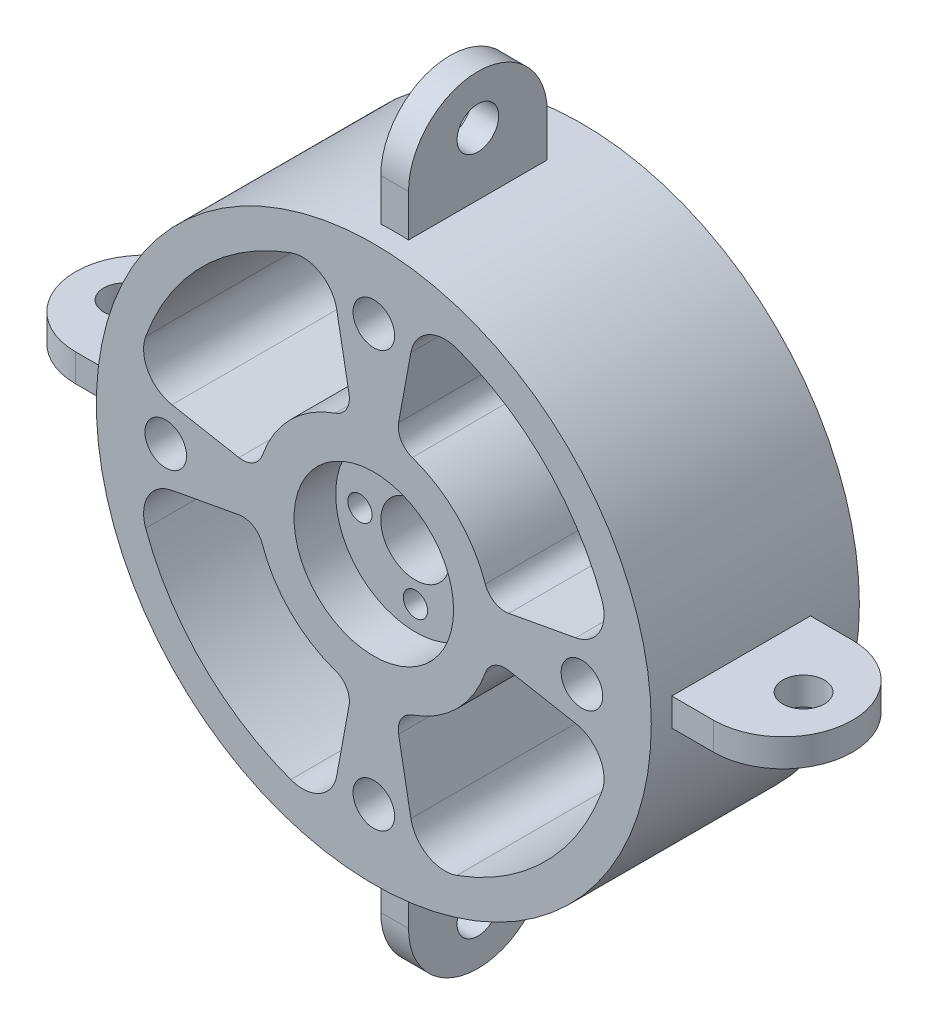
from build123d import *

# Parameters (mm, degrees)
SKETCH_1_R               = 40
EXTRUDE_1_DEPTH          = 30
SKETCH_2_R               = 3
CUT_EXTRUDE_1_DEPTH      = 65.031242374
EXTRUDE_2_DEPTH          = 2
SKETCH_4_R               = 3
CUT_EXTRUDE_2_DEPTH      = 77.157731059
PATTERN_CIRCULAR_2_COUNT = 4
CUT_EXTRUDE_3_REACH      = 86.688
SKETCH_5_R               = 5
SKETCH_6_R               = 11.5
CUT_EXTRUDE_4_DEPTH      = 6
CUT_EXTRUDE_5_REACH      = 84.753
SKETCH_7_R               = 1.75
CUT_EXTRUDE_6_REACH      = 86.688


with BuildPart() as part:
    # 草图1 → 凸台-拉伸1 (new body)
    with BuildSketch(Plane.XY):
        Circle(SKETCH_1_R)
    extrude(amount=EXTRUDE_1_DEPTH)

    # 草图2 → 切除-拉伸1 (cut, through all)
    with BuildSketch(Plane.XY.offset(30)):
        with Locations((30, 0)):
            Circle(SKETCH_2_R)
        with Locations((0, 30)):
            Circle(SKETCH_2_R)
        with Locations((-30, 0)):
            Circle(SKETCH_2_R)
        with Locations((0, -30)):
            Circle(SKETCH_2_R)
    extrude(amount=-CUT_EXTRUDE_1_DEPTH, mode=Mode.SUBTRACT)

    # 草图3 → 凸台-拉伸2 (add, symmetric)
    with BuildSketch(Plane(origin=(0, 0, 0), x_dir=(0, 0, -1), z_dir=(1, 0, 0))):
        with BuildLine():
            Line((-7, 38), (-27, 38))
            Line((-27, 38), (-27, 46))
            ThreePointArc((-27, 46), (-17, 56), (-7, 46))
            Line((-7, 46), (-7, 38))
        make_face()
    extrude_2 = extrude(amount=EXTRUDE_2_DEPTH, both=True)

    # 草图4 → 切除-拉伸2 (cut, through all)
    with BuildSketch(Plane(origin=(2, 0, 0), x_dir=(0, 0, -1), z_dir=(1, 0, 0))):
        with Locations((-17, 48.949968711)):
            Circle(SKETCH_4_R)
    cut_extrude_2 = extrude(amount=-CUT_EXTRUDE_2_DEPTH, mode=Mode.SUBTRACT)

    # 阵列(圆周)2: 凸台-拉伸2, 切除-拉伸2 ×4 about axis
    pattern_circular_2_axis = Axis((0, 0, 30), (0, 0, -1))
    add([extrude_2.rotate(pattern_circular_2_axis, i * 360 / PATTERN_CIRCULAR_2_COUNT) for i in range(1, PATTERN_CIRCULAR_2_COUNT)])
    add([cut_extrude_2.rotate(pattern_circular_2_axis, i * 360 / PATTERN_CIRCULAR_2_COUNT) for i in range(1, PATTERN_CIRCULAR_2_COUNT)], mode=Mode.SUBTRACT)

    # 草图5 → 切除-拉伸3 (cut, up to next)
    with BuildSketch(Plane(origin=(0, 0, 0), x_dir=(-1, 0, 0), z_dir=(0, 0, -1)), mode=Mode.PRIVATE) as cut_extrude_3_sk1:
        Circle(SKETCH_5_R)
    cut_extrude_3_tool1 = extrude(cut_extrude_3_sk1.sketch, amount=-CUT_EXTRUDE_3_REACH, mode=Mode.PRIVATE) & part.part
    add(cut_extrude_3_tool1.solids().sort_by_distance((0, 0, 0))[0], mode=Mode.SUBTRACT)

    # 草图6 → 切除-拉伸4 (cut)
    with BuildSketch(Plane.XY.offset(30)):
        Circle(SKETCH_6_R)
    extrude(amount=-CUT_EXTRUDE_4_DEPTH, mode=Mode.SUBTRACT)

    # 草图7 → 切除-拉伸5 (cut, up to next)
    with BuildSketch(Plane.XY.offset(24), mode=Mode.PRIVATE) as cut_extrude_5_sk1:
        with Locations((-8, 0)):
            Circle(SKETCH_7_R)
    cut_extrude_5_tool1 = extrude(cut_extrude_5_sk1.sketch, amount=-CUT_EXTRUDE_5_REACH, mode=Mode.PRIVATE) & part.part
    # 草图7 → 切除-拉伸5 (cut, up to next)
    with BuildSketch(Plane.XY.offset(24), mode=Mode.PRIVATE) as cut_extrude_5_sk2:
        with Locations((0, 8)):
            Circle(SKETCH_7_R)
    cut_extrude_5_tool2 = extrude(cut_extrude_5_sk2.sketch, amount=-CUT_EXTRUDE_5_REACH, mode=Mode.PRIVATE) & part.part
    # 草图7 → 切除-拉伸5 (cut, up to next)
    with BuildSketch(Plane.XY.offset(24), mode=Mode.PRIVATE) as cut_extrude_5_sk3:
        with Locations((8, 0)):
            Circle(SKETCH_7_R)
    cut_extrude_5_tool3 = extrude(cut_extrude_5_sk3.sketch, amount=-CUT_EXTRUDE_5_REACH, mode=Mode.PRIVATE) & part.part
    # 草图7 → 切除-拉伸5 (cut, up to next)
    with BuildSketch(Plane.XY.offset(24), mode=Mode.PRIVATE) as cut_extrude_5_sk4:
        with Locations((0, -8)):
            Circle(SKETCH_7_R)
    cut_extrude_5_tool4 = extrude(cut_extrude_5_sk4.sketch, amount=-CUT_EXTRUDE_5_REACH, mode=Mode.PRIVATE) & part.part
    add(cut_extrude_5_tool1.solids().sort_by_distance((-8, 0, 24))[0], mode=Mode.SUBTRACT)
    add(cut_extrude_5_tool2.solids().sort_by_distance((0, 8, 24))[0], mode=Mode.SUBTRACT)
    add(cut_extrude_5_tool3.solids().sort_by_distance((8, 0, 24))[0], mode=Mode.SUBTRACT)
    add(cut_extrude_5_tool4.solids().sort_by_distance((0, -8, 24))[0], mode=Mode.SUBTRACT)

    # 草图8 → 切除-拉伸6 (cut, up to next)
    with BuildSketch(Plane.XY.offset(30), mode=Mode.PRIVATE) as cut_extrude_6_sk1:
        with BuildLine():
            Line((-19.448497144, 3.571548523), (-29.093883486, 5.342840417))
            ThreePointArc((-29.093883486, 5.342840417), (-32.529734513, 7.775959095), (-32.889241728, 11.970705016))
            ThreePointArc((-32.889241728, 11.970705016), (-24.748737342, 24.748737342), (-11.970705016, 32.889241728))
            ThreePointArc((-11.970705016, 32.889241728), (-7.775959095, 32.529734513), (-5.342840417, 29.093883486))
            Line((-5.342840417, 29.093883486), (-3.571548523, 19.448497144))
            ThreePointArc((-3.571548523, 19.448497144), (-3.93150799, 17.393928239), (-5.543875825, 16.070639092))
            ThreePointArc((-5.543875825, 16.070639092), (-12.02081528, 12.02081528), (-16.070639092, 5.543875825))
            ThreePointArc((-16.070639092, 5.543875825), (-17.393928239, 3.93150799), (-19.448497144, 3.571548523))
        make_face()
    cut_extrude_6_tool1 = extrude(cut_extrude_6_sk1.sketch, amount=-CUT_EXTRUDE_6_REACH, mode=Mode.PRIVATE) & part.part
    # 草图8 → 切除-拉伸6 (cut, up to next)
    with BuildSketch(Plane.XY.offset(30), mode=Mode.PRIVATE) as cut_extrude_6_sk2:
        with BuildLine():
            Line((19.448497144, 3.571548523), (29.093883486, 5.342840417))
            ThreePointArc((29.093883486, 5.342840417), (32.529734513, 7.775959095), (32.889241728, 11.970705016))
            ThreePointArc((32.889241728, 11.970705016), (24.748737342, 24.748737342), (11.970705016, 32.889241728))
            ThreePointArc((11.970705016, 32.889241728), (7.775959095, 32.529734513), (5.342840417, 29.093883486))
            Line((5.342840417, 29.093883486), (3.571548523, 19.448497144))
            ThreePointArc((3.571548523, 19.448497144), (3.93150799, 17.393928239), (5.543875825, 16.070639092))
            ThreePointArc((5.543875825, 16.070639092), (12.02081528, 12.02081528), (16.070639092, 5.543875825))
            ThreePointArc((16.070639092, 5.543875825), (17.393928239, 3.93150799), (19.448497144, 3.571548523))
        make_face()
    cut_extrude_6_tool2 = extrude(cut_extrude_6_sk2.sketch, amount=-CUT_EXTRUDE_6_REACH, mode=Mode.PRIVATE) & part.part
    # 草图8 → 切除-拉伸6 (cut, up to next)
    with BuildSketch(Plane.XY.offset(30), mode=Mode.PRIVATE) as cut_extrude_6_sk3:
        with BuildLine():
            Line((3.571548523, -19.448497144), (5.342840417, -29.093883486))
            ThreePointArc((5.342840417, -29.093883486), (7.775959095, -32.529734513), (11.970705016, -32.889241728))
            ThreePointArc((11.970705016, -32.889241728), (24.748737342, -24.748737342), (32.889241728, -11.970705016))
            ThreePointArc((32.889241728, -11.970705016), (32.529734513, -7.775959095), (29.093883486, -5.342840417))
            Line((29.093883486, -5.342840417), (19.448497144, -3.571548523))
            ThreePointArc((19.448497144, -3.571548523), (17.393928239, -3.93150799), (16.070639092, -5.543875825))
            ThreePointArc((16.070639092, -5.543875825), (12.02081528, -12.02081528), (5.543875825, -16.070639092))
            ThreePointArc((5.543875825, -16.070639092), (3.93150799, -17.393928239), (3.571548523, -19.448497144))
        make_face()
    cut_extrude_6_tool3 = extrude(cut_extrude_6_sk3.sketch, amount=-CUT_EXTRUDE_6_REACH, mode=Mode.PRIVATE) & part.part
    # 草图8 → 切除-拉伸6 (cut, up to next)
    with BuildSketch(Plane.XY.offset(30), mode=Mode.PRIVATE) as cut_extrude_6_sk4:
        with BuildLine():
            Line((-19.448497144, -3.571548523), (-29.093883486, -5.342840417))
            ThreePointArc((-29.093883486, -5.342840417), (-32.529734513, -7.775959095), (-32.889241728, -11.970705016))
            ThreePointArc((-32.889241728, -11.970705016), (-24.748737342, -24.748737342), (-11.970705016, -32.889241728))
            ThreePointArc((-11.970705016, -32.889241728), (-7.775959095, -32.529734513), (-5.342840417, -29.093883486))
            Line((-5.342840417, -29.093883486), (-3.571548523, -19.448497144))
            ThreePointArc((-3.571548523, -19.448497144), (-3.93150799, -17.393928239), (-5.543875825, -16.070639092))
            ThreePointArc((-5.543875825, -16.070639092), (-12.02081528, -12.02081528), (-16.070639092, -5.543875825))
            ThreePointArc((-16.070639092, -5.543875825), (-17.393928239, -3.93150799), (-19.448497144, -3.571548523))
        make_face()
    cut_extrude_6_tool4 = extrude(cut_extrude_6_sk4.sketch, amount=-CUT_EXTRUDE_6_REACH, mode=Mode.PRIVATE) & part.part
    add(cut_extrude_6_tool1.solids().sort_by_distance((-17.964712, 17.964712, 30))[0], mode=Mode.SUBTRACT)
    add(cut_extrude_6_tool2.solids().sort_by_distance((17.964712, 17.964712, 30))[0], mode=Mode.SUBTRACT)
    add(cut_extrude_6_tool3.solids().sort_by_distance((17.964712, -17.964712, 30))[0], mode=Mode.SUBTRACT)
    add(cut_extrude_6_tool4.solids().sort_by_distance((-17.964712, -17.964712, 30))[0], mode=Mode.SUBTRACT)


solid = part.part
